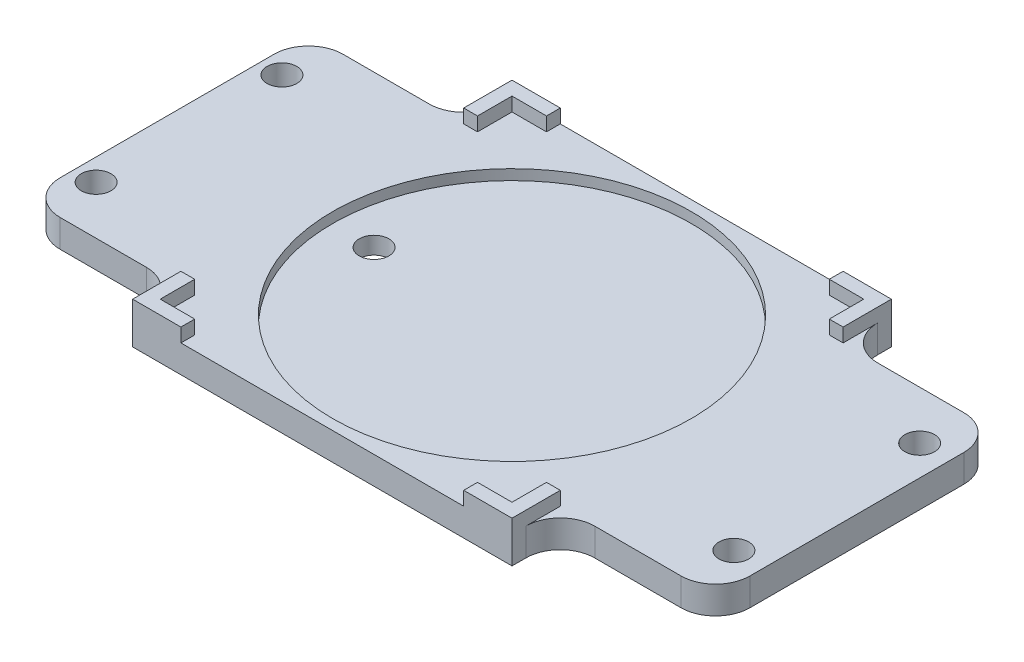
from build123d import *

# Parameters (mm, degrees)
SKETCH1_W               = 100
SKETCH1_H               = 55
BOSS_EXTRUDE1_DEPTH     = 4
F_6_CLEARANCE_HOLE1_D   = 4.3053
SKETCH4_R               = 26
CUT_EXTRUDE1_DEPTH      = 1.5
BOSS_EXTRUDE2_DEPTH     = 2
CUT_EXTRUDE2_REACH      = 59.204
SKETCH7_W               = 22.5
SKETCH7_H               = 7
MIRROR2_COPY_1_DEPTH    = 2
MIRROR2_COPY_2_REACH    = 59.204
MIRROR2_COPY_2_SKETCH_W = 22.5
MIRROR2_COPY_2_SKETCH_H = 7
MIRROR2_COPY_3_DEPTH    = 2
MIRROR2_COPY_4_REACH    = 59.204
MIRROR2_COPY_4_SKETCH_W = 22.5
MIRROR2_COPY_4_SKETCH_H = 7
FILLET1_R               = 5


with BuildPart() as part:
    # Sketch1 → Boss-Extrude1 (new body)
    with BuildSketch(Plane(origin=(0, 0, 0), x_dir=(1, 0, 0), z_dir=(0, 1, 0))):
        Rectangle(SKETCH1_W, SKETCH1_H)
    extrude(amount=BOSS_EXTRUDE1_DEPTH)

    # #6 Clearance Hole1 (through all)
    with Locations(Plane(origin=(0, 4, 0), x_dir=(1, 0, 0), z_dir=(0, 1, 0))):
        with Locations((45.6352, 13.470384182), (45.6352, -13.470384182), (-46.825, -13.470384182), (-46.825, 13.470384182), (-20, 0)):
            Hole(F_6_CLEARANCE_HOLE1_D / 2)

    # Sketch4 → Cut-Extrude1 (cut)
    with BuildSketch(Plane(origin=(0, 4, 0), x_dir=(1, 0, 0), z_dir=(0, 1, 0))):
        Circle(SKETCH4_R)
    extrude(amount=-CUT_EXTRUDE1_DEPTH, mode=Mode.SUBTRACT)

    # Sketch6 → Boss-Extrude2 (add)
    with BuildSketch(Plane(origin=(0, 4, 0), x_dir=(1, 0, 0), z_dir=(0, 1, 0))):
        Polygon((-20.5, 25.5), (-20.5, 27.5), (-27.5, 27.5), (-27.5, 20.5), (-25.5, 20.5), (-25.5, 25.5), align=None)
    boss_extrude2 = extrude(amount=BOSS_EXTRUDE2_DEPTH)

    # Sketch7 → Cut-Extrude2 (cut, up to next)
    with BuildSketch(Plane(origin=(0, 4, 0), x_dir=(1, 0, 0), z_dir=(0, 1, 0)), mode=Mode.PRIVATE) as cut_extrude2_sk1:
        with Locations((-38.75, 24)):
            Rectangle(SKETCH7_W, SKETCH7_H)
    cut_extrude2_tool1 = extrude(cut_extrude2_sk1.sketch, amount=-CUT_EXTRUDE2_REACH, mode=Mode.PRIVATE) & part.part
    cut_extrude2 = cut_extrude2_tool1.solids().sort_by_distance((-38.75, 4, -24))[0]
    add(cut_extrude2, mode=Mode.SUBTRACT)

    # Mirror1: Boss-Extrude2, Cut-Extrude2 across plane
    add(boss_extrude2.mirror(Plane.XY))
    add(cut_extrude2.mirror(Plane.XY), mode=Mode.SUBTRACT)

    # Mirror2 copy 1 sketch → Mirror2 copy 1 (add)
    with BuildSketch(Plane(origin=(0, 4, 0), x_dir=(-1, 0, 0), z_dir=(0, 1, 0))):
        Polygon((-20.5, 25.5), (-20.5, 27.5), (-27.5, 27.5), (-27.5, 20.5), (-25.5, 20.5), (-25.5, 25.5), align=None)
    extrude(amount=MIRROR2_COPY_1_DEPTH)

    # Mirror2 copy 2 sketch → Mirror2 copy 2 (cut, up to next)
    with BuildSketch(Plane(origin=(0, 4, 0), x_dir=(-1, 0, 0), z_dir=(0, 1, 0)), mode=Mode.PRIVATE) as mirror2_copy_2_sk1:
        with Locations((-38.75, 24)):
            Rectangle(MIRROR2_COPY_2_SKETCH_W, MIRROR2_COPY_2_SKETCH_H)
    mirror2_copy_2_tool1 = extrude(mirror2_copy_2_sk1.sketch, amount=-MIRROR2_COPY_2_REACH, mode=Mode.PRIVATE) & part.part
    add(mirror2_copy_2_tool1.solids().sort_by_distance((38.75, 4, 24))[0], mode=Mode.SUBTRACT)

    # Mirror2 copy 3 sketch → Mirror2 copy 3 (add)
    with BuildSketch(Plane(origin=(0, 4, 0), x_dir=(-1, 0, 0), z_dir=(0, 1, 0))):
        Polygon((-20.5, -25.5), (-20.5, -27.5), (-27.5, -27.5), (-27.5, -20.5), (-25.5, -20.5), (-25.5, -25.5), align=None)
    extrude(amount=MIRROR2_COPY_3_DEPTH)

    # Mirror2 copy 4 sketch → Mirror2 copy 4 (cut, up to next)
    with BuildSketch(Plane(origin=(0, 4, 0), x_dir=(-1, 0, 0), z_dir=(0, 1, 0)), mode=Mode.PRIVATE) as mirror2_copy_4_sk1:
        with Locations((-38.75, -24)):
            Rectangle(MIRROR2_COPY_4_SKETCH_W, MIRROR2_COPY_4_SKETCH_H)
    mirror2_copy_4_tool1 = extrude(mirror2_copy_4_sk1.sketch, amount=-MIRROR2_COPY_4_REACH, mode=Mode.PRIVATE) & part.part
    add(mirror2_copy_4_tool1.solids().sort_by_distance((38.75, 4, -24))[0], mode=Mode.SUBTRACT)

    # Fillet1
    fillet1_edges = [part.edges().sort_by_distance(p)[0] for p in [
        (-50, 2, -20.5),
        (-27.5, 2, -20.5),
        (50, 2, -20.5),
        (27.5, 2, -20.5),
        (50, 2, 20.5),
        (27.5, 2, 20.5),
        (-27.5, 2, 20.5),
        (-50, 2, 20.5),
    ]]
    fillet(fillet1_edges, radius=FILLET1_R)


solid = part.part
